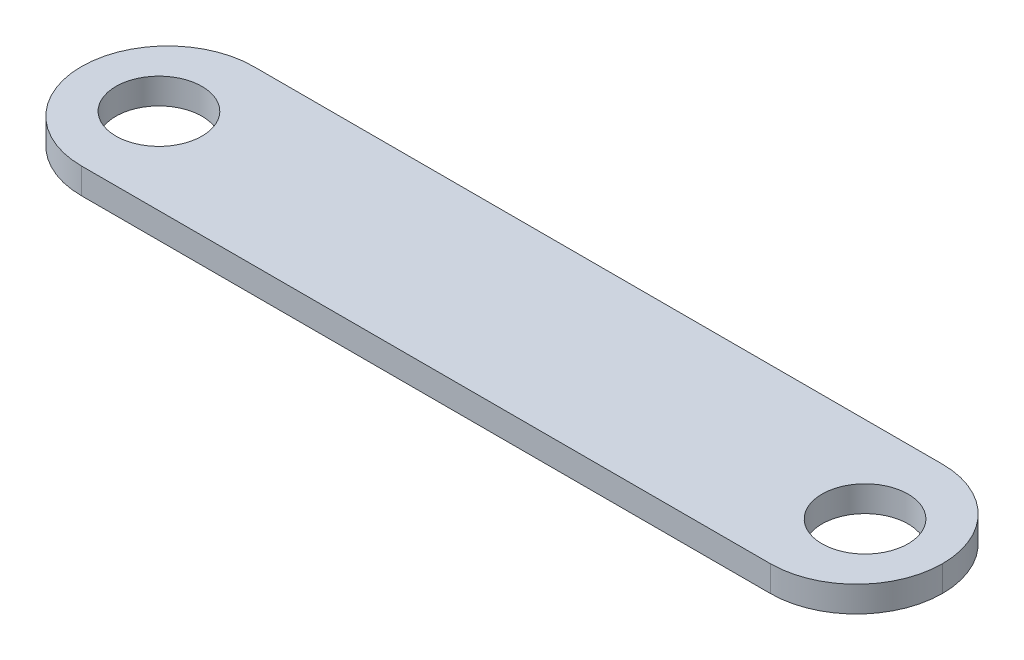
from build123d import *

# Parameters (mm, degrees)
SKETCH2_W           = 100
SKETCH2_H           = 20
BOSS_EXTRUDE1_DEPTH = 3
SKETCH3_R           = 5
CUT_EXTRUDE1_DEPTH  = 103.02450686
SKETCH4_R           = 5
CUT_EXTRUDE2_DEPTH  = 103.02450686
FILLET1_R           = 10
FILLET2_R           = 10


with BuildPart() as part:
    # Sketch2 → Boss-Extrude1 (new body)
    with BuildSketch(Plane(origin=(0, 0, 0), x_dir=(1, 0, 0), z_dir=(0, 1, 0))):
        with Locations((50, 10)):
            Rectangle(SKETCH2_W, SKETCH2_H)
    extrude(amount=BOSS_EXTRUDE1_DEPTH)

    # Sketch3 → Cut-Extrude1 (cut, through all)
    with BuildSketch(Plane(origin=(0, 3, 0), x_dir=(1, 0, 0), z_dir=(0, 1, 0))):
        with Locations(Location((9, 10, 0), (0, 0, 270))):
            Circle(SKETCH3_R)
    extrude(amount=-CUT_EXTRUDE1_DEPTH, mode=Mode.SUBTRACT)

    # Sketch4 → Cut-Extrude2 (cut, through all)
    with BuildSketch(Plane(origin=(0, 3, 0), x_dir=(1, 0, 0), z_dir=(0, 1, 0))):
        with Locations(Location((91, 10, 0), (0, 0, 270))):
            Circle(SKETCH4_R)
    extrude(amount=-CUT_EXTRUDE2_DEPTH, mode=Mode.SUBTRACT)

    # Fillet1
    fillet1_edges = [part.edges().sort_by_distance(p)[0] for p in [
        (0, 1.5, -20),
        (0, 1.5, 0),
    ]]
    fillet(fillet1_edges, radius=FILLET1_R - 0.0001)  # a hair under: the kernel refuses the full size

    # Fillet2
    fillet2_edges = [part.edges().sort_by_distance(p)[0] for p in [
        (100, 1.5, -20),
        (100, 1.5, 0),
    ]]
    fillet(fillet2_edges, radius=FILLET2_R - 0.0001)  # a hair under: the kernel refuses the full size


solid = part.part
